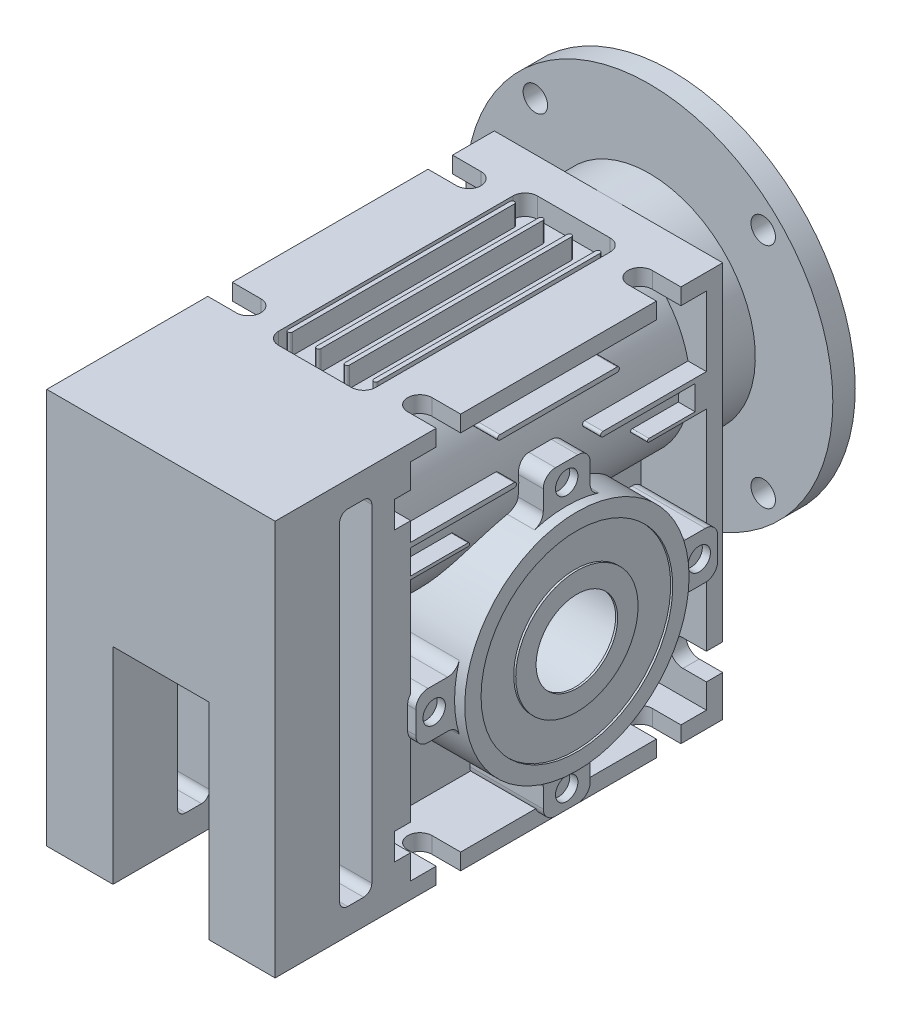
from build123d import *
from build123d.topology import SkipClean

# Parameters (mm, degrees)
SKETCH1_W           = 80.5
SKETCH1_H           = 97
BOSS_EXTRUDE1_DEPTH = 28
SKETCH2_R           = 27.5
BOSS_EXTRUDE2_DEPTH = 32.5
BOSS_EXTRUDE3_START = 2
SKETCH3_R           = 2.75
BOSS_EXTRUDE3_DEPTH = 2
SKETCH4_R           = 26
BOSS_EXTRUDE4_DEPTH = 10
SKETCH7_R           = 45
BOSS_EXTRUDE5_DEPTH = 5.5
SKETCH9_R           = 3
CUT_EXTRUDE1_DEPTH  = 5.5
CUT_EXTRUDE2_START  = -16
CUT_EXTRUDE2_DEPTH  = 16
SKETCH11_R          = 23.5
SKETCH11_R_2        = 15
CUT_EXTRUDE3_DEPTH  = 0.5
SKETCH11_3_R        = 10
CUT_EXTRUDE4_DEPTH  = 75
BOSS_EXTRUDE6_START = -85
SKETCH12_R          = 24
BOSS_EXTRUDE6_DEPTH = 85
CUT_EXTRUDE5_DEPTH  = 5
SKETCH14_W          = 23.523230104
SKETCH14_H          = 100.970530334
CUT_EXTRUDE7_DEPTH  = 25
SKETCH15_W          = 23.523230104
SKETCH15_H          = 161
CUT_EXTRUDE8_DEPTH  = 25
SKETCH16_R          = 27.5
BOSS_EXTRUDE7_DEPTH = 55
CUT_EXTRUDE9_START  = -5
CUT_EXTRUDE9_DEPTH  = 5
CUT_EXTRUDE10_DEPTH = 5
CUT_EXTRUDE11_START = -5
CUT_EXTRUDE11_DEPTH = 5
SKETCH20_R          = 10
CUT_EXTRUDE12_DEPTH = 117.921180716
SKETCH21_W          = 23.852383712
SKETCH21_H          = 63.476672692
CUT_EXTRUDE13_DEPTH = 5
FILLET1_R           = 3
FILLET2_R           = 8
CUT_EXTRUDE14_START = -20
SKETCH22_R          = 5.5
CUT_EXTRUDE14_DEPTH = 20
BOSS_EXTRUDE8_DEPTH = 29.24
SKETCH28_W          = 7.90840556
SKETCH28_H          = 84.41331094
CUT_EXTRUDE15_DEPTH = 102.24
FILLET3_R           = 2
CUT_EXTRUDE16_START = -137
SKETCH29_R          = 15
SKETCH29_R_2        = 10
CUT_EXTRUDE16_DEPTH = 137


with BuildPart() as part:
    # Sketch1 → Boss-Extrude1 (new, symmetric)
    with BuildSketch(Plane(origin=(0, 0, 0), x_dir=(0, 0, -1), z_dir=(1, 0, 0))):
        Rectangle(SKETCH1_W, SKETCH1_H)
    extrude(amount=BOSS_EXTRUDE1_DEPTH, both=True)

    # Sketch2 → Boss-Extrude2 (add, symmetric)
    with BuildSketch(Plane(origin=(0, 0, 0), x_dir=(0, 0, -1), z_dir=(1, 0, 0))):
        with Locations((0, -9.5)):
            Circle(SKETCH2_R)
    extrude(amount=BOSS_EXTRUDE2_DEPTH, both=True)

    # Sketch3 → Boss-Extrude3 (add)
    # profile 1 of 4: a face of its own
    with BuildSketch(Plane(origin=(28, 0, 0), x_dir=(0, 0, -1), z_dir=(1, 0, 0)).offset(BOSS_EXTRUDE3_START)):
        with BuildLine():
            Line((-34, -15.25), (-29.217931138, -15.25))
            ThreePointArc((-29.217931138, -15.25), (-27.42655837, -15.843553739), (-26.344036272, -17.389344262))
            ThreePointArc((-26.344036272, -17.389344262), (-27.5, -9.5), (-26.344036272, -1.610655738))
            ThreePointArc((-26.344036272, -1.610655738), (-27.42655837, -3.156446261), (-29.217931138, -3.75))
            Line((-29.217931138, -3.75), (-34, -3.75))
            ThreePointArc((-34, -3.75), (-36.121320344, -4.628679656), (-37, -6.75))
            Line((-37, -6.75), (-37, -12.25))
            ThreePointArc((-37, -12.25), (-36.121320344, -14.371320344), (-34, -15.25))
        make_face()
        with Locations((-32.5, -9.5)):
            Circle(SKETCH3_R, mode=Mode.SUBTRACT)
    # profile 2 of 4: a face of its own
    with BuildSketch(Plane(origin=(28, 0, 0), x_dir=(0, 0, -1), z_dir=(1, 0, 0)).offset(BOSS_EXTRUDE3_START)):
        with BuildLine():
            ThreePointArc((7.889344262, -35.844036272), (0, -37), (-7.889344262, -35.844036272))
            ThreePointArc((-7.889344262, -35.844036272), (-6.343553739, -36.92655837), (-5.75, -38.717931138))
            Line((-5.75, -38.717931138), (-5.75, -43.5))
            ThreePointArc((-5.75, -43.5), (-4.871320344, -45.621320344), (-2.75, -46.5))
            Line((-2.75, -46.5), (2.75, -46.5))
            ThreePointArc((2.75, -46.5), (4.871320344, -45.621320344), (5.75, -43.5))
            Line((5.75, -43.5), (5.75, -38.717931138))
            ThreePointArc((5.75, -38.717931138), (6.343553739, -36.92655837), (7.889344262, -35.844036272))
        make_face()
        with Locations((0, -42)):
            Circle(SKETCH3_R, mode=Mode.SUBTRACT)
    # profile 3 of 4: a face of its own
    with BuildSketch(Plane(origin=(28, 0, 0), x_dir=(0, 0, -1), z_dir=(1, 0, 0)).offset(BOSS_EXTRUDE3_START)):
        with BuildLine():
            ThreePointArc((-5.75, 19.717931138), (-6.343553739, 17.92655837), (-7.889344262, 16.844036272))
            ThreePointArc((-7.889344262, 16.844036272), (0, 18), (7.889344262, 16.844036272))
            ThreePointArc((7.889344262, 16.844036272), (6.343553739, 17.92655837), (5.75, 19.717931138))
            Line((5.75, 19.717931138), (5.75, 24.5))
            ThreePointArc((5.75, 24.5), (4.871320344, 26.621320344), (2.75, 27.5))
            Line((2.75, 27.5), (-2.75, 27.5))
            ThreePointArc((-2.75, 27.5), (-4.871320344, 26.621320344), (-5.75, 24.5))
            Line((-5.75, 24.5), (-5.75, 19.717931138))
        make_face()
        with Locations((0, 23)):
            Circle(SKETCH3_R, mode=Mode.SUBTRACT)
    # profile 4 of 4: a face of its own
    with BuildSketch(Plane(origin=(28, 0, 0), x_dir=(0, 0, -1), z_dir=(1, 0, 0)).offset(BOSS_EXTRUDE3_START)):
        with BuildLine():
            ThreePointArc((26.344036272, -1.610655738), (27.5, -9.5), (26.344036272, -17.389344262))
            ThreePointArc((26.344036272, -17.389344262), (27.42655837, -15.843553739), (29.217931138, -15.25))
            Line((29.217931138, -15.25), (34, -15.25))
            ThreePointArc((34, -15.25), (36.121320344, -14.371320344), (37, -12.25))
            Line((37, -12.25), (37, -6.75))
            ThreePointArc((37, -6.75), (36.121320344, -4.628679656), (34, -3.75))
            Line((34, -3.75), (29.217931138, -3.75))
            ThreePointArc((29.217931138, -3.75), (27.42655837, -3.156446261), (26.344036272, -1.610655738))
        make_face()
        with Locations((32.5, -9.5)):
            Circle(SKETCH3_R, mode=Mode.SUBTRACT)
    boss_extrude3 = extrude(amount=-BOSS_EXTRUDE3_DEPTH)

    # Mirror1: Boss-Extrude3 across plane
    add(boss_extrude3.mirror(Plane(origin=(0, 0, 0), x_dir=(0, 0, 1), z_dir=(1, 0, 0))))

    # Sketch4 → Boss-Extrude4 (add)
    with BuildSketch(Plane(origin=(0, 0, -40.25), x_dir=(-1, 0, 0), z_dir=(0, 0, -1))):
        with Locations((0, 22.5)):
            Circle(SKETCH4_R)
    extrude(amount=BOSS_EXTRUDE4_DEPTH)

    # Sketch7 → Boss-Extrude5 (add)
    with BuildSketch(Plane(origin=(0, 0, -50.25), x_dir=(-1, 0, 0), z_dir=(0, 0, -1))):
        with Locations((0, 22.5)):
            Circle(SKETCH7_R)
    extrude(amount=BOSS_EXTRUDE5_DEPTH)

    # Sketch8 → Cut-Revolve1 (revolve, cut)
    with BuildSketch(Plane(origin=(0, 0, 0), x_dir=(0, 0, -1), z_dir=(1, 0, 0))):
        Polygon((55.75, 53), (52.75, 53), (52.75, 46.5), (45.75, 46.5), (45.75, 32.5), (50.75, 32.5), (50.75, 28), (22.75, 28), (22.75, 22.5), (55.75, 22.5), align=None)
    revolve(axis=Axis((0, 22.5, -22.75), (0, 0, -1)), mode=Mode.SUBTRACT)

    # Sketch9 → Cut-Extrude1 (cut)
    with BuildSketch(Plane(origin=(0, 0, -55.75), x_dir=(-1, 0, 0), z_dir=(0, 0, -1))):
        with Locations((27.930717857, 50.430717857)):
            Circle(SKETCH9_R)
        with Locations((27.930717857, -5.430717857)):
            Circle(SKETCH9_R)
        with Locations((-27.930717857, -5.430717857)):
            Circle(SKETCH9_R)
        with Locations((-27.930717857, 50.430717857)):
            Circle(SKETCH9_R)
    extrude(amount=-CUT_EXTRUDE1_DEPTH, mode=Mode.SUBTRACT)

    # Sketch10 → Cut-Extrude2 (cut)
    # profile 1 of 3: a face of its own
    with BuildSketch(Plane.ZY.offset(28).offset(CUT_EXTRUDE2_START)):
        with BuildLine():
            ThreePointArc((26.344036272, -1.610655738), (27.42655837, -3.156446261), (29.217931138, -3.75))
            Line((29.217931138, -3.75), (34, -3.75))
            ThreePointArc((34, -3.75), (35.234313483, -4.015686517), (36.25, -4.765686517))
            Line((36.25, -4.765686517), (36.25, 19.450708437))
            Line((36.25, 19.450708437), (22.185862277, 19.450708437))
            ThreePointArc((22.185862277, 19.450708437), (21.785601092, 19.850969621), (22.185862277, 20.251230806))
            Line((22.185862277, 20.251230806), (36.25, 20.251230806))
            Line((36.25, 20.251230806), (36.25, 26.234499308))
            Line((36.25, 26.234499308), (10.891268802, 26.234499308))
            ThreePointArc((10.891268802, 26.234499308), (10.310253872, 26.815514237), (10.891268802, 27.396529166))
            Line((10.891268802, 27.396529166), (36.25, 27.396529166))
            Line((36.25, 27.396529166), (36.25, 44.5))
            Line((36.25, 44.5), (-36.25, 44.5))
            Line((-36.25, 44.5), (-36.25, 27.396529166))
            Line((-36.25, 27.396529166), (-10.891268802, 27.396529166))
            ThreePointArc((-10.891268802, 27.396529166), (-10.310253872, 26.815514237), (-10.891268802, 26.234499308))
            Line((-10.891268802, 26.234499308), (-33.486222621, 26.234499308))
            Line((-33.486222621, 26.234499308), (-33.486222621, 20.251230806))
            Line((-33.486222621, 20.251230806), (-22.185862277, 20.251230806))
            ThreePointArc((-22.185862277, 20.251230806), (-21.785601092, 19.850969621), (-22.185862277, 19.450708437))
            Line((-22.185862277, 19.450708437), (-36.25, 19.450708437))
            Line((-36.25, 19.450708437), (-36.25, -4.765686517))
            ThreePointArc((-36.25, -4.765686517), (-35.234313483, -4.015686517), (-34, -3.75))
            Line((-34, -3.75), (-29.217931138, -3.75))
            ThreePointArc((-29.217931138, -3.75), (-27.42655837, -3.156446261), (-26.344036272, -1.610655738))
            ThreePointArc((-26.344036272, -1.610655738), (-19.445436483, 9.945436483), (-7.889344262, 16.844036272))
            ThreePointArc((-7.889344262, 16.844036272), (-6.343553739, 17.92655837), (-5.75, 19.717931138))
            Line((-5.75, 19.717931138), (-5.75, 24.5))
            ThreePointArc((-5.75, 24.5), (-4.871320344, 26.621320344), (-2.75, 27.5))
            Line((-2.75, 27.5), (2.75, 27.5))
            ThreePointArc((2.75, 27.5), (4.871320344, 26.621320344), (5.75, 24.5))
            Line((5.75, 24.5), (5.75, 19.717931138))
            ThreePointArc((5.75, 19.717931138), (6.343553739, 17.92655837), (7.889344262, 16.844036272))
            ThreePointArc((7.889344262, 16.844036272), (19.445436483, 9.945436483), (26.344036272, -1.610655738))
        make_face()
        with BuildLine():
            ThreePointArc((-14.353449684, 38.155290258), (-14.939575387, 38.74141596), (-14.353449684, 39.327541662))
            Line((-14.353449684, 39.327541662), (14.353449684, 39.327541662))
            ThreePointArc((14.353449684, 39.327541662), (14.939575387, 38.74141596), (14.353449684, 38.155290258))
            Line((14.353449684, 38.155290258), (-14.353449684, 38.155290258))
        make_face(mode=Mode.SUBTRACT)
    # profile 2 of 3: a face of its own
    with BuildSketch(Plane.ZY.offset(28).offset(CUT_EXTRUDE2_START)):
        with BuildLine():
            Line((36.25, -44.5), (36.25, -14.234313483))
            ThreePointArc((36.25, -14.234313483), (35.234313483, -14.984313483), (34, -15.25))
            Line((34, -15.25), (29.217931138, -15.25))
            ThreePointArc((29.217931138, -15.25), (27.42655837, -15.843553739), (26.344036272, -17.389344262))
            ThreePointArc((26.344036272, -17.389344262), (19.445436483, -28.945436483), (7.889344262, -35.844036272))
            ThreePointArc((7.889344262, -35.844036272), (6.343553739, -36.92655837), (5.75, -38.717931138))
            Line((5.75, -38.717931138), (5.75, -43.5))
            ThreePointArc((5.75, -43.5), (5.706795679, -44.007305936), (5.578427125, -44.5))
            Line((5.578427125, -44.5), (36.25, -44.5))
        make_face()
    # profile 3 of 3: a face of its own
    with BuildSketch(Plane.ZY.offset(28).offset(CUT_EXTRUDE2_START)):
        with BuildLine():
            Line((-36.25, -44.5), (-5.578427125, -44.5))
            ThreePointArc((-5.578427125, -44.5), (-5.706795679, -44.007305936), (-5.75, -43.5))
            Line((-5.75, -43.5), (-5.75, -38.717931138))
            ThreePointArc((-5.75, -38.717931138), (-6.343553739, -36.92655837), (-7.889344262, -35.844036272))
            ThreePointArc((-7.889344262, -35.844036272), (-19.445436483, -28.945436483), (-26.344036272, -17.389344262))
            ThreePointArc((-26.344036272, -17.389344262), (-27.42655837, -15.843553739), (-29.217931138, -15.25))
            Line((-29.217931138, -15.25), (-34, -15.25))
            ThreePointArc((-34, -15.25), (-35.234313483, -14.984313483), (-36.25, -14.234313483))
            Line((-36.25, -14.234313483), (-36.25, -44.5))
        make_face()
    cut_extrude2 = extrude(amount=CUT_EXTRUDE2_DEPTH, mode=Mode.SUBTRACT)

    # Sketch11 → Cut-Extrude3 (cut)
    with BuildSketch(Plane.ZY.offset(32.5)):
        with Locations((0, -9.5)):
            Circle(SKETCH11_R)
        with Locations((0, -9.5)):
            Circle(SKETCH11_R_2, mode=Mode.SUBTRACT)
    cut_extrude3 = extrude(amount=-CUT_EXTRUDE3_DEPTH, mode=Mode.SUBTRACT)

    # Sketch11<3> → Cut-Extrude4 (cut)
    with BuildSketch(Plane.ZY.offset(32.5)):
        with Locations((0, -9.5)):
            Circle(SKETCH11_3_R)
    extrude(amount=-CUT_EXTRUDE4_DEPTH, mode=Mode.SUBTRACT)

    # Mirror3: Cut-Extrude2, Cut-Extrude3 across plane
    add(cut_extrude2.mirror(Plane(origin=(0, 0, 0), x_dir=(0, 0, 1), z_dir=(1, 0, 0))), mode=Mode.SUBTRACT)
    add(cut_extrude3.mirror(Plane(origin=(0, 0, 0), x_dir=(0, 0, 1), z_dir=(1, 0, 0))), mode=Mode.SUBTRACT)

    # Sketch12 → Boss-Extrude6 (add)
    with SkipClean():  # the faces are left unmerged after this step: merging them gives an invalid solid
        with BuildSketch(Plane(origin=(0, 0, -45.75), x_dir=(-1, 0, 0), z_dir=(0, 0, -1)).offset(BOSS_EXTRUDE6_START)):
            with Locations((0, 22.5)):
                Circle(SKETCH12_R)
        extrude(amount=BOSS_EXTRUDE6_DEPTH)

    # Sketch13 → Cut-Extrude5 (cut)
    with SkipClean():  # the faces are left unmerged after this step: merging them gives an invalid solid
        with BuildSketch(Plane.XY.offset(40.25)):
            with BuildLine():
                Line((28, -38.5), (28, -32))
                Line((28, -32), (22.25, -32))
                ThreePointArc((22.25, -32), (19, -35.25), (22.25, -38.5))
                Line((22.25, -38.5), (28, -38.5))
            make_face()
            with BuildLine():
                Line((22.25, 32), (28, 32))
                Line((28, 32), (28, 38.5))
                Line((28, 38.5), (22.25, 38.5))
                ThreePointArc((22.25, 38.5), (19, 35.25), (22.25, 32))
            make_face()
            with BuildLine():
                Line((-22.25, -32), (-28, -32))
                Line((-28, -32), (-28, -38.5))
                Line((-28, -38.5), (-22.25, -38.5))
                ThreePointArc((-22.25, -38.5), (-19, -35.25), (-22.25, -32))
            make_face()
            with BuildLine():
                Line((-28, 38.5), (-28, 32))
                Line((-28, 32), (-22.25, 32))
                ThreePointArc((-22.25, 32), (-19, 35.25), (-22.25, 38.5))
                Line((-22.25, 38.5), (-28, 38.5))
            make_face()
        extrude(amount=-CUT_EXTRUDE5_DEPTH, mode=Mode.SUBTRACT)

    # Sketch14 → Cut-Extrude7 (cut)
    with SkipClean():  # the faces are left unmerged after this step: merging them gives an invalid solid
        with BuildSketch(Plane.XY.offset(40.25)):
            with Locations((0, -48.5)):
                Rectangle(SKETCH14_W, SKETCH14_H)
            with BuildLine():
                ThreePointArc((-6.185971798, -95.750573948), (-6.853269421, -96.417871571), (-7.520567044, -95.750573948))
                Line((-7.520567044, -95.750573948), (-7.520567044, -1.249426052))
                ThreePointArc((-7.520567044, -1.249426052), (-6.853269421, -0.582128429), (-6.185971798, -1.249426052))
                Line((-6.185971798, -1.249426052), (-6.185971798, -95.750573948))
            make_face(mode=Mode.SUBTRACT)
            with BuildLine():
                ThreePointArc((0.814028202, -95.750573948), (0.146730579, -96.417871571), (-0.520567044, -95.750573948))
                Line((-0.520567044, -95.750573948), (-0.520567044, -1.249426052))
                ThreePointArc((-0.520567044, -1.249426052), (0.146730579, -0.582128429), (0.814028202, -1.249426052))
                Line((0.814028202, -1.249426052), (0.814028202, -95.750573948))
            make_face(mode=Mode.SUBTRACT)
            with BuildLine():
                ThreePointArc((7.814028202, -95.750573948), (7.146730579, -96.417871571), (6.479432956, -95.750573948))
                Line((6.479432956, -95.750573948), (6.479432956, -1.249426052))
                ThreePointArc((6.479432956, -1.249426052), (7.146730579, -0.582128429), (7.814028202, -1.249426052))
                Line((7.814028202, -1.249426052), (7.814028202, -95.750573948))
            make_face(mode=Mode.SUBTRACT)
        extrude(amount=-CUT_EXTRUDE7_DEPTH, mode=Mode.SUBTRACT)

    # Sketch15 → Cut-Extrude8 (cut)
    with SkipClean():  # the faces are left unmerged after this step: merging them gives an invalid solid
        with BuildSketch(Plane.XZ.offset(48.5)):
            with Locations((0, 40.25)):
                Rectangle(SKETCH15_W, SKETCH15_H)
            with BuildLine():
                Line((-6.185971798, 117.61076031), (-6.185971798, -37.11076031))
                ThreePointArc((-6.185971798, -37.11076031), (-6.853269421, -37.778057934), (-7.520567044, -37.11076031))
                Line((-7.520567044, -37.11076031), (-7.520567044, 117.61076031))
                ThreePointArc((-7.520567044, 117.61076031), (-6.853269421, 118.278057934), (-6.185971798, 117.61076031))
            make_face(mode=Mode.SUBTRACT)
            with BuildLine():
                Line((0.814028202, 117.61076031), (0.814028202, -37.11076031))
                ThreePointArc((0.814028202, -37.11076031), (0.146730579, -37.778057934), (-0.520567044, -37.11076031))
                Line((-0.520567044, -37.11076031), (-0.520567044, 117.61076031))
                ThreePointArc((-0.520567044, 117.61076031), (0.146730579, 118.278057934), (0.814028202, 117.61076031))
            make_face(mode=Mode.SUBTRACT)
            with BuildLine():
                Line((7.814028202, 117.61076031), (7.814028202, -37.11076031))
                ThreePointArc((7.814028202, -37.11076031), (7.146730579, -37.778057934), (6.479432956, -37.11076031))
                Line((6.479432956, -37.11076031), (6.479432956, 117.61076031))
                ThreePointArc((6.479432956, 117.61076031), (7.146730579, 118.278057934), (7.814028202, 117.61076031))
            make_face(mode=Mode.SUBTRACT)
        extrude(amount=-CUT_EXTRUDE8_DEPTH, mode=Mode.SUBTRACT)

    # Sketch16 → Boss-Extrude7 (add)
    with BuildSketch(Plane.ZY.offset(32)):
        with Locations((0, -9.5)):
            Circle(SKETCH16_R)
    extrude(amount=-BOSS_EXTRUDE7_DEPTH)

    # Sketch17 → Cut-Extrude9 (cut)
    with BuildSketch(Plane(origin=(0, 0, -40.25), x_dir=(-1, 0, 0), z_dir=(0, 0, -1)).offset(CUT_EXTRUDE9_START)):
        with BuildLine():
            Line((-22.25, -32), (-28, -32))
            Line((-28, -32), (-28, -38.5))
            Line((-28, -38.5), (-22.25, -38.5))
            ThreePointArc((-22.25, -38.5), (-19, -35.25), (-22.25, -32))
        make_face()
        with BuildLine():
            Line((28, -38.5), (28, -32))
            Line((28, -32), (22.25, -32))
            ThreePointArc((22.25, -32), (19, -35.25), (22.25, -38.5))
            Line((22.25, -38.5), (28, -38.5))
        make_face()
    extrude(amount=CUT_EXTRUDE9_DEPTH, mode=Mode.SUBTRACT)

    # Sketch18 → Cut-Extrude10 (cut)
    with BuildSketch(Plane.XZ.offset(48.5)):
        with BuildLine():
            Line((35, 24), (21, 24))
            ThreePointArc((21, 24), (18, 27), (21, 30))
            Line((21, 30), (35, 30))
            ThreePointArc((35, 30), (38, 27), (35, 24))
        make_face()
        with BuildLine():
            Line((-35, 24), (-21, 24))
            ThreePointArc((-21, 24), (-18, 27), (-21, 30))
            Line((-21, 30), (-35, 30))
            ThreePointArc((-35, 30), (-38, 27), (-35, 24))
        make_face()
        with BuildLine():
            Line((-35, -24), (-21, -24))
            ThreePointArc((-21, -24), (-18, -27), (-21, -30))
            Line((-21, -30), (-35, -30))
            ThreePointArc((-35, -30), (-38, -27), (-35, -24))
        make_face()
        with BuildLine():
            Line((35, -24), (21, -24))
            ThreePointArc((21, -24), (18, -27), (21, -30))
            Line((21, -30), (35, -30))
            ThreePointArc((35, -30), (38, -27), (35, -24))
        make_face()
    extrude(amount=-CUT_EXTRUDE10_DEPTH, mode=Mode.SUBTRACT)

    # Sketch19 → Cut-Extrude11 (cut)
    with BuildSketch(Plane(origin=(0, 48.5, 0), x_dir=(1, 0, 0), z_dir=(0, 1, 0)).offset(CUT_EXTRUDE11_START)):
        with BuildLine():
            Line((35, -24), (21, -24))
            ThreePointArc((21, -24), (18, -27), (21, -30))
            Line((21, -30), (35, -30))
            ThreePointArc((35, -30), (38, -27), (35, -24))
        make_face()
        with BuildLine():
            Line((-35, 24), (-21, 24))
            ThreePointArc((-21, 24), (-18, 27), (-21, 30))
            Line((-21, 30), (-35, 30))
            ThreePointArc((-35, 30), (-38, 27), (-35, 24))
        make_face()
        with BuildLine():
            Line((-21, -24), (-35, -24))
            ThreePointArc((-35, -24), (-38, -27), (-35, -30))
            Line((-35, -30), (-21, -30))
            ThreePointArc((-21, -30), (-18, -27), (-21, -24))
        make_face()
        with BuildLine():
            Line((35, 30), (21, 30))
            ThreePointArc((21, 30), (18, 27), (21, 24))
            Line((21, 24), (35, 24))
            ThreePointArc((35, 24), (38, 27), (35, 30))
        make_face()
    extrude(amount=CUT_EXTRUDE11_DEPTH, mode=Mode.SUBTRACT)

    # Sketch20 → Cut-Extrude12 (cut, through all)
    with BuildSketch(Plane(origin=(32.5, 0, 0), x_dir=(0, 0, -1), z_dir=(1, 0, 0))):
        with Locations((0, -9.5)):
            Circle(SKETCH20_R)
    extrude(amount=-CUT_EXTRUDE12_DEPTH, mode=Mode.SUBTRACT)

    # Sketch21 → Cut-Extrude13 (cut)
    with BuildSketch(Plane(origin=(0, 48.5, 0), x_dir=(1, 0, 0), z_dir=(0, 1, 0))):
        Rectangle(SKETCH21_W, SKETCH21_H)
        with BuildLine():
            Line((-11.106334683, -27.229336929), (-11.106334683, 27.229336929))
            ThreePointArc((-11.106334683, 27.229336929), (-10.57723267, 27.758438942), (-10.048130656, 27.229336929))
            Line((-10.048130656, 27.229336929), (-10.048130656, -27.229336929))
            ThreePointArc((-10.048130656, -27.229336929), (-10.57723267, -27.758438942), (-11.106334683, -27.229336929))
        make_face(mode=Mode.SUBTRACT)
        with BuildLine():
            Line((-4.106334683, -27.229336929), (-4.106334683, 27.229336929))
            ThreePointArc((-4.106334683, 27.229336929), (-3.57723267, 27.758438942), (-3.048130656, 27.229336929))
            Line((-3.048130656, 27.229336929), (-3.048130656, -27.229336929))
            ThreePointArc((-3.048130656, -27.229336929), (-3.57723267, -27.758438942), (-4.106334683, -27.229336929))
        make_face(mode=Mode.SUBTRACT)
        with BuildLine():
            Line((2.893665317, -27.229336929), (2.893665317, 27.229336929))
            ThreePointArc((2.893665317, 27.229336929), (3.42276733, 27.758438942), (3.951869344, 27.229336929))
            Line((3.951869344, 27.229336929), (3.951869344, -27.229336929))
            ThreePointArc((3.951869344, -27.229336929), (3.42276733, -27.758438942), (2.893665317, -27.229336929))
        make_face(mode=Mode.SUBTRACT)
        with BuildLine():
            Line((9.893665317, -27.229336929), (9.893665317, 27.229336929))
            ThreePointArc((9.893665317, 27.229336929), (10.42276733, 27.758438942), (10.951869344, 27.229336929))
            Line((10.951869344, 27.229336929), (10.951869344, -27.229336929))
            ThreePointArc((10.951869344, -27.229336929), (10.42276733, -27.758438942), (9.893665317, -27.229336929))
        make_face(mode=Mode.SUBTRACT)
    extrude(amount=-CUT_EXTRUDE13_DEPTH, mode=Mode.SUBTRACT)

    # Fillet1
    fillet1_edges = [part.edges().sort_by_distance(p)[0] for p in [
        (-11.926191856, 46, 31.738336346),
        (11.926191856, 46, 31.738336346),
        (11.926191856, 46, -31.738336346),
        (-11.926191856, 46, -31.738336346),
    ]]
    fillet(fillet1_edges, radius=FILLET1_R)

    # Fillet2
    fillet2_edges = [part.edges().sort_by_distance(p)[0] for p in [
        (7.146730579, -48.5, 40.25),
        (0.146730579, -48.5, 40.25),
        (-6.853269421, -48.5, 40.25),
    ]]
    fillet(fillet2_edges, radius=FILLET2_R)

    # Sketch22 → Cut-Extrude14 (cut)
    with BuildSketch(Plane(origin=(0, 0, -45.75), x_dir=(-1, 0, 0), z_dir=(0, 0, -1)).offset(CUT_EXTRUDE14_START)):
        with Locations((0, 22.5)):
            Circle(SKETCH22_R)
    extrude(amount=CUT_EXTRUDE14_DEPTH, mode=Mode.SUBTRACT)

    # Sketch25 → Boss-Extrude8 (add)
    with BuildSketch(Plane.XY.offset(40.25)):
        Polygon((28, 48.5), (-28, 48.5), (-28, -48.5), (-11.761615052, -48.5), (-11.761615052, 1.985265167), (11.761615052, 1.985265167), (11.761615052, -48.5), (28, -48.5), align=None)
    extrude(amount=BOSS_EXTRUDE8_DEPTH)

    # Sketch28 → Cut-Extrude15 (cut)
    with BuildSketch(Plane(origin=(28, 0, 0), x_dir=(0, 0, -1), z_dir=(1, 0, 0))):
        with Locations((-49.745, 0)):
            Rectangle(SKETCH28_W, SKETCH28_H)
    extrude(amount=-CUT_EXTRUDE15_DEPTH, mode=Mode.SUBTRACT)

    # Fillet3
    fillet3_edges = [part.edges().sort_by_distance(p)[0] for p in [
        (0, 42.20665547, 53.69920278),
        (0, 42.20665547, 45.79079722),
        (-19.880807526, -42.20665547, 53.69920278),
        (19.880807526, -42.20665547, 53.69920278),
        (19.880807526, -42.20665547, 45.79079722),
        (-19.880807526, -42.20665547, 45.79079722),
    ]]
    fillet(fillet3_edges, radius=FILLET3_R)

    # Sketch29 → Cut-Extrude16 (cut)
    with BuildSketch(Plane(origin=(32, 0, 0), x_dir=(0, 0, -1), z_dir=(1, 0, 0)).offset(CUT_EXTRUDE16_START)):
        with Locations((0, -9.5)):
            Circle(SKETCH29_R)
        with Locations((0, -9.5)):
            Circle(SKETCH29_R_2, mode=Mode.SUBTRACT)
    extrude(amount=CUT_EXTRUDE16_DEPTH, mode=Mode.SUBTRACT)


with BuildPart() as cut_extrude16_piece_1:
    # of the separate pieces the step leaves, piece 1, a body of its own (cut_extrude16_pieces)
    add(part.part.solids().sort_by_distance((11.761615052, -40.20665547, 45.79079722))[0])


with BuildPart() as cut_extrude16_piece_2:
    # of the separate pieces the step leaves, piece 2, a body of its own (cut_extrude16_pieces)
    add(part.part.solids().sort_by_distance((32.5, -9.5, 15))[0])


solid = Compound([cut_extrude16_piece_1.part, cut_extrude16_piece_2.part])
